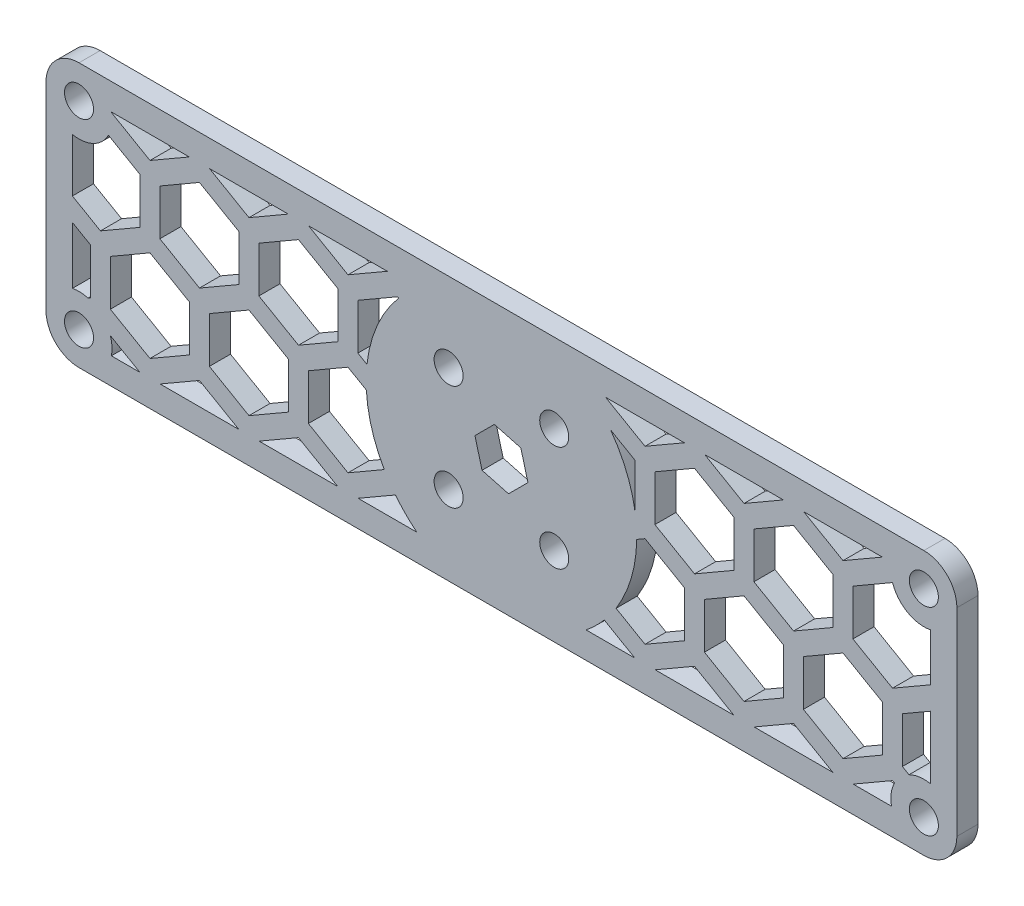
from build123d import *

# Parameters (mm, degrees)
STOCK_BODY_PITCH_GIMBAL_BOX_MASTER_1_START = -30.2
STOCK_BODY_PITCH_GIMBAL_BOX_MASTER_1_OUT_W = 138
STOCK_BODY_PITCH_GIMBAL_BOX_MASTER_1_OUT_H = 40
STOCK_BODY_PITCH_GIMBAL_BOX_MASTER_1_OUT_R = 2.2
STOCK_BODY_PITCH_GIMBAL_BOX_MASTER_1_DEPTH = 3.2
BOSS_EXTRUDE1_DEPTH                        = 3.2
BOSS_EXTRUDE1_2_DEPTH                      = 3.2
CUT_EXTRUDE1_DEPTH                         = 72.911334294
CUT_EXTRUDE2_DEPTH                         = 72.911334294
FILL_START                                 = -30.2
FILL_PATTERN1_DEPTH                        = 3.2
FILLET1_R                                  = 5


# Read off the part's stored shape, not the designer's step: Stock-body_pitch_gimbal_box_master-1, Fill Pattern1
with BuildPart() as part:
    # Stock-body_pitch_gimbal_box_master-1 out → Stock-body_pitch_gimbal_box_master-1 (new body)
    with BuildSketch(Plane.XY.offset(STOCK_BODY_PITCH_GIMBAL_BOX_MASTER_1_START)):
        Rectangle(STOCK_BODY_PITCH_GIMBAL_BOX_MASTER_1_OUT_W, STOCK_BODY_PITCH_GIMBAL_BOX_MASTER_1_OUT_H)
        with Locations((-64, -15)):
            Circle(STOCK_BODY_PITCH_GIMBAL_BOX_MASTER_1_OUT_R, mode=Mode.SUBTRACT)
        with Locations((-8, -8)):
            Circle(STOCK_BODY_PITCH_GIMBAL_BOX_MASTER_1_OUT_R, mode=Mode.SUBTRACT)
        with Locations((64, -15)):
            Circle(STOCK_BODY_PITCH_GIMBAL_BOX_MASTER_1_OUT_R, mode=Mode.SUBTRACT)
        with Locations((8, -8)):
            Circle(STOCK_BODY_PITCH_GIMBAL_BOX_MASTER_1_OUT_R, mode=Mode.SUBTRACT)
        with Locations((-8, 8)):
            Circle(STOCK_BODY_PITCH_GIMBAL_BOX_MASTER_1_OUT_R, mode=Mode.SUBTRACT)
        with Locations((-64, 15)):
            Circle(STOCK_BODY_PITCH_GIMBAL_BOX_MASTER_1_OUT_R, mode=Mode.SUBTRACT)
        Polygon((1.075890567, -4.015278258), (-2.939387691, -2.939387691), (-4.015278258, 1.075890567), (-1.075890567, 4.015278258), (2.939387691, 2.939387691), (4.015278258, -1.075890567), align=None, mode=Mode.SUBTRACT)
        with Locations((8, 8)):
            Circle(STOCK_BODY_PITCH_GIMBAL_BOX_MASTER_1_OUT_R, mode=Mode.SUBTRACT)
        with Locations((64, 15)):
            Circle(STOCK_BODY_PITCH_GIMBAL_BOX_MASTER_1_OUT_R, mode=Mode.SUBTRACT)
    extrude(amount=STOCK_BODY_PITCH_GIMBAL_BOX_MASTER_1_DEPTH)

    # Sketch1<3> → Cut-Extrude1 (cut, through all)
    with BuildSketch(Plane.XY.offset(-27)):
        with BuildLine():
            ThreePointArc((-59, 15), (-60.83772234, 11.127016654), (-65, 10.101020514))
            Line((-65, 10.101020514), (-65, -10.101020514))
            ThreePointArc((-65, -10.101020514), (-60.83772234, -11.127016654), (-59, -15))
            ThreePointArc((-59, -15), (-59.025319235, -15.50254481), (-59.101020514, -16))
            Line((-59.101020514, -16), (-12.816005618, -16))
            ThreePointArc((-12.816005618, -16), (-20.5, 0), (-12.816005618, 16))
            Line((-12.816005618, 16), (-59.101020514, 16))
            ThreePointArc((-59.101020514, 16), (-59.025319235, 15.50254481), (-59, 15))
        make_face()
        with BuildLine():
            Line((59.101020514, 16), (12.816005618, 16))
            ThreePointArc((12.816005618, 16), (18.479422545, 8.874736189), (20.5, 0))
            ThreePointArc((20.5, 0), (18.479422545, -8.874736189), (12.816005618, -16))
            Line((12.816005618, -16), (59.101020514, -16))
            ThreePointArc((59.101020514, -16), (60.464466094, -11.464466094), (65, -10.101020514))
            Line((65, -10.101020514), (65, 10.101020514))
            ThreePointArc((65, 10.101020514), (60.464466094, 11.464466094), (59.101020514, 16))
        make_face()
    extrude(amount=-CUT_EXTRUDE1_DEPTH, mode=Mode.SUBTRACT)


with BuildPart() as body_2:
    # Sketch1 → Boss-Extrude1 (new body)
    with BuildSketch(Plane.XY.offset(-27)):
        with BuildLine():
            ThreePointArc((-59, 15), (-60.83772234, 11.127016654), (-65, 10.101020514))
            Line((-65, 10.101020514), (-65, -10.101020514))
            ThreePointArc((-65, -10.101020514), (-60.83772234, -11.127016654), (-59, -15))
            ThreePointArc((-59, -15), (-59.025319235, -15.50254481), (-59.101020514, -16))
            Line((-59.101020514, -16), (-12.816005618, -16))
            ThreePointArc((-12.816005618, -16), (-20.5, 0), (-12.816005618, 16))
            Line((-12.816005618, 16), (-59.101020514, 16))
            ThreePointArc((-59.101020514, 16), (-59.025319235, 15.50254481), (-59, 15))
        make_face()
    extrude(amount=-BOSS_EXTRUDE1_DEPTH)

    # Sketch2 → Cut-Extrude2 (cut, through all)
    with BuildSketch(Plane.XY.offset(-27)):
        Polygon((-39.75, 9.959292144), (-45.75, 13.423393759), (-51.75, 9.959292144), (-51.75, 3.031088913), (-45.75, -0.433012702), (-39.75, 3.031088913), align=None)
        Polygon((-32.25, -3.031088913), (-38.25, 0.433012702), (-44.25, -3.031088913), (-44.25, -9.959292144), (-38.25, -13.423393759), (-32.25, -9.959292144), align=None)
    extrude(amount=-CUT_EXTRUDE2_DEPTH, mode=Mode.SUBTRACT)


with BuildPart() as body_3:
    # Sketch1 → Boss-Extrude1 2 (new body)
    with BuildSketch(Plane.XY.offset(-27)):
        with BuildLine():
            Line((59.101020514, 16), (12.816005618, 16))
            ThreePointArc((12.816005618, 16), (18.479422545, 8.874736189), (20.5, 0))
            ThreePointArc((20.5, 0), (18.479422545, -8.874736189), (12.816005618, -16))
            Line((12.816005618, -16), (59.101020514, -16))
            ThreePointArc((59.101020514, -16), (60.464466094, -11.464466094), (65, -10.101020514))
            Line((65, -10.101020514), (65, 10.101020514))
            ThreePointArc((65, 10.101020514), (60.464466094, 11.464466094), (59.101020514, 16))
        make_face()
    extrude(amount=-BOSS_EXTRUDE1_2_DEPTH)


with BuildPart() as fill_pattern1_tool:
    # Fill Pattern1 outline → Fill Pattern1 (new body)
    with BuildSketch(Plane.XY.offset(FILL_START)):
        with BuildLine():
            Line((60.75, -3.031088913), (60.75, -9.959292144))
            Line((60.75, -9.959292144), (61.748349319, -10.535689391))
            ThreePointArc((61.748349319, -10.535689391), (63.337511045, -10.044083497), (65, -10.101020514))
            Line((65, -10.101020514), (65, -0.577350269))
            Line((65, -0.577350269), (60.75, -3.031088913))
        make_face()
        with BuildLine():
            ThreePointArc((59.101020514, -16), (59.045592222, -14.326320868), (59.545904633, -12.728208975))
            Line((59.545904633, -12.728208975), (59.25, -12.557368355))
            Line((59.25, -12.557368355), (53.287187079, -16))
            Line((53.287187079, -16), (59.101020514, -16))
        make_face()
        with BuildLine():
            Line((59.25, -0.433012702), (65, 2.886751346))
            Line((65, 2.886751346), (65, 10.101020514))
            ThreePointArc((65, 10.101020514), (61.498525152, 10.67072482), (59.256281646, 13.419767048))
            Line((59.256281646, 13.419767048), (59.25, 13.423393759))
            Line((59.25, 13.423393759), (53.25, 9.959292144))
            Line((53.25, 9.959292144), (53.25, 3.031088913))
            Line((53.25, 3.031088913), (59.25, -0.433012702))
        make_face()
        Polygon((38.287187079, -16), (50.212812921, -16), (44.25, -12.557368355), align=None)
        Polygon((23.287187079, -16), (35.212812921, -16), (29.25, -12.557368355), align=None)
        Polygon((51.75, 12.557368355), (57.712812921, 16), (45.787187079, 16), align=None)
        with BuildLine():
            Line((12.816005618, -16), (20.212812921, -16))
            Line((20.212812921, -16), (15.578957288, -13.324642203))
            ThreePointArc((15.578957288, -13.324642203), (14.260359899, -14.72725825), (12.816005618, -16))
        make_face()
        Polygon((36.75, 12.557368355), (42.712812921, 16), (30.787187079, 16), align=None)
        with BuildLine():
            ThreePointArc((20.497950682, -0.289858309), (19.6605329, -5.806328107), (17.366635353, -10.892657))
            Line((17.366635353, -10.892657), (21.75, -13.423393759))
            Line((21.75, -13.423393759), (27.75, -9.959292144))
            Line((27.75, -9.959292144), (27.75, -3.031088913))
            Line((27.75, -3.031088913), (21.75, 0.433012702))
            Line((21.75, 0.433012702), (20.497950682, -0.289858309))
        make_face()
        Polygon((21.75, 12.557368355), (27.712812921, 16), (15.787187079, 16), align=None)
        with BuildLine():
            ThreePointArc((16.55243861, 12.094080207), (18.931919632, 7.863359272), (20.25, 3.191786334))
            Line((20.25, 3.191786334), (20.25, 9.959292144))
            Line((20.25, 9.959292144), (16.55243861, 12.094080207))
        make_face()
        Polygon((38.25, 9.959292144), (38.25, 3.031088913), (44.25, -0.433012702), (50.25, 3.031088913), (50.25, 9.959292144), (44.25, 13.423393759), align=None)
        Polygon((30.75, -9.959292144), (36.75, -13.423393759), (42.75, -9.959292144), (42.75, -3.031088913), (36.75, 0.433012702), (30.75, -3.031088913), align=None)
        Polygon((51.75, -13.423393759), (57.75, -9.959292144), (57.75, -3.031088913), (51.75, 0.433012702), (45.75, -3.031088913), (45.75, -9.959292144), align=None)
        Polygon((23.25, 9.959292144), (23.25, 3.031088913), (29.25, -0.433012702), (35.25, 3.031088913), (35.25, 9.959292144), (29.25, 13.423393759), align=None)
        with BuildLine():
            ThreePointArc((-12.816005618, -16), (-14.531036564, -14.460255059), (-16.06238879, -12.737726107))
            Line((-16.06238879, -12.737726107), (-21.712812921, -16))
            Line((-21.712812921, -16), (-12.816005618, -16))
        make_face()
        with BuildLine():
            Line((-23.25, -13.423393759), (-17.753520778, -10.25))
            ThreePointArc((-17.753520778, -10.25), (-19.641345656, -5.870906302), (-20.46634849, -1.174129247))
            Line((-20.46634849, -1.174129247), (-23.25, 0.433012702))
            Line((-23.25, 0.433012702), (-29.25, -3.031088913))
            Line((-29.25, -3.031088913), (-29.25, -9.959292144))
            Line((-29.25, -9.959292144), (-23.25, -13.423393759))
        make_face()
        Polygon((-36.712812921, -16), (-24.787187079, -16), (-30.75, -12.557368355), align=None)
        with BuildLine():
            Line((-21.75, 3.031088913), (-20.377403668, 2.238620052))
            ThreePointArc((-20.377403668, 2.238620052), (-18.813291713, 8.143098607), (-15.578957288, 13.324642203))
            Line((-15.578957288, 13.324642203), (-15.75, 13.423393759))
            Line((-15.75, 13.423393759), (-21.75, 9.959292144))
            Line((-21.75, 9.959292144), (-21.75, 3.031088913))
        make_face()
        Polygon((-51.712812921, -16), (-39.787187079, -16), (-45.75, -12.557368355), align=None)
        with BuildLine():
            Line((-59.101020514, -16), (-54.787187079, -16))
            Line((-54.787187079, -16), (-59.256281646, -13.419767048))
            ThreePointArc((-59.256281646, -13.419767048), (-59.009027557, -14.699676717), (-59.101020514, -16))
        make_face()
        Polygon((-23.25, 12.557368355), (-17.287187079, 16), (-29.212812921, 16), align=None)
        with BuildLine():
            ThreePointArc((-65, -10.101020514), (-63.817209659, -10.003342348), (-62.644717974, -10.187182672))
            Line((-62.644717974, -10.187182672), (-62.25, -9.959292144))
            Line((-62.25, -9.959292144), (-62.25, -3.031088913))
            Line((-62.25, -3.031088913), (-65, -1.443375673))
            Line((-65, -1.443375673), (-65, -10.101020514))
        make_face()
        Polygon((-38.25, 12.557368355), (-32.287187079, 16), (-44.212812921, 16), align=None)
        with BuildLine():
            Line((-53.25, 12.557368355), (-47.287187079, 16))
            Line((-47.287187079, 16), (-59.101020514, 16))
            ThreePointArc((-59.101020514, 16), (-59.09373641, 15.963627308), (-59.086722353, 15.927201577))
            Line((-59.086722353, 15.927201577), (-53.25, 12.557368355))
        make_face()
        with BuildLine():
            Line((-65, 10.101020514), (-65, 2.020725942))
            Line((-65, 2.020725942), (-60.75, -0.433012702))
            Line((-60.75, -0.433012702), (-54.75, 3.031088913))
            Line((-54.75, 3.031088913), (-54.75, 9.959292144))
            Line((-54.75, 9.959292144), (-59.545904633, 12.728208975))
            ThreePointArc((-59.545904633, 12.728208975), (-61.83015588, 10.495360558), (-65, 10.101020514))
        make_face()
        Polygon((-24.75, 3.031088913), (-24.75, 9.959292144), (-30.75, 13.423393759), (-36.75, 9.959292144), (-36.75, 3.031088913), (-30.75, -0.433012702), align=None)
        Polygon((-59.25, -9.959292144), (-53.25, -13.423393759), (-47.25, -9.959292144), (-47.25, -3.031088913), (-53.25, 0.433012702), (-59.25, -3.031088913), align=None)
    extrude(amount=FILL_PATTERN1_DEPTH)


with BuildPart() as body_2_1:
    add(body_2.part)

    # Fill Pattern1: cut by fill_pattern1_tool
    add(fill_pattern1_tool.part, mode=Mode.SUBTRACT)


with BuildPart() as body_3_1:
    add(body_3.part)

    # Fill Pattern1: cut by fill_pattern1_tool
    add(fill_pattern1_tool.part, mode=Mode.SUBTRACT)


with BuildPart() as part_1:
    add(part.part)

    # Combine1: union body 2, body 3
    add(body_2_1.part)
    add(body_3_1.part)

    # Fillet1
    fillet1_edges = [part_1.edges().sort_by_distance(p)[0] for p in [
        (-69, -20, -28.6),
        (69, -20, -28.6),
        (69, 20, -28.6),
        (-69, 20, -28.6),
    ]]
    fillet(fillet1_edges, radius=FILLET1_R)


solid = part_1.part
